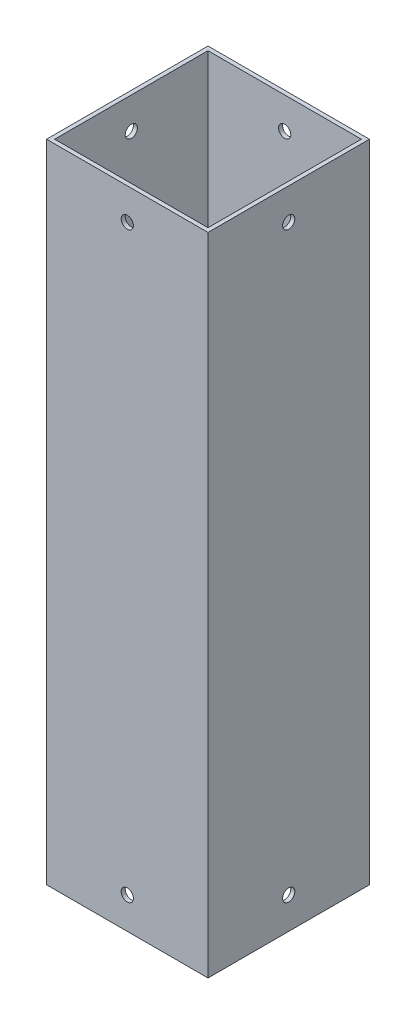
from build123d import *

# Parameters (mm, degrees)
SKETCH1_W               = 63.5
SKETCH1_H               = 63.5
SKETCH1_W_2             = 60.325
SKETCH1_H_2             = 60.325
BOSS_EXTRUDE1_DEPTH     = 254
SKETCH3_W               = 60.325
SKETCH3_H               = 60.325
BOSS_EXTRUDE3_DEPTH     = 2.54
CUT_EXTRUDE1_DEPTH      = 264.357589897
CUT_EXTRUDE1_DEPTH_BACK = 264.357589897
SKETCH4_R               = 2.3999952
SKETCH5_R               = 2.3999952
CUT_EXTRUDE2_DEPTH      = 264.735307648
CUT_EXTRUDE3_DEPTH      = 264.735307648
CUT_EXTRUDE3_DEPTH_BACK = 264.735307648
SKETCH6_R               = 2.3999952
CUT_EXTRUDE4_DEPTH      = 264.735307648
CUT_EXTRUDE4_DEPTH_BACK = 264.735307648
SKETCH7_R               = 2.3999952


with BuildPart() as part:
    # Sketch1 → Boss-Extrude1 (new body)
    with BuildSketch(Plane(origin=(0, 0, 0), x_dir=(1, 0, 0), z_dir=(0, 1, 0))):
        Rectangle(SKETCH1_W, SKETCH1_H)
        Rectangle(SKETCH1_W_2, SKETCH1_H_2, mode=Mode.SUBTRACT)
    extrude(amount=BOSS_EXTRUDE1_DEPTH)

    # Sketch3 → Boss-Extrude3 (add)
    with BuildSketch(Plane(origin=(0, 152.4, 0), x_dir=(1, 0, 0), z_dir=(0, 1, 0))):
        Rectangle(SKETCH3_W, SKETCH3_H)
    extrude(amount=-BOSS_EXTRUDE3_DEPTH)

    # Sketch4 → Cut-Extrude1 (cut, two sides: drawn at the far end of the back side and taken through both)
    with BuildSketch(Plane(origin=(-30.1625, 0, 0), x_dir=(0, 0, -1), z_dir=(1, 0, 0)).offset(-CUT_EXTRUDE1_DEPTH_BACK)):
        with Locations((0, 241.587599882)):
            Circle(SKETCH4_R)
    extrude(amount=CUT_EXTRUDE1_DEPTH + CUT_EXTRUDE1_DEPTH_BACK, mode=Mode.SUBTRACT)

    # Sketch5 → Cut-Extrude2 (cut, through all)
    with BuildSketch(Plane(origin=(0, 0, -31.75), x_dir=(-1, 0, 0), z_dir=(0, 0, -1))):
        with Locations((0, 241.587599882)):
            Circle(SKETCH5_R)
    extrude(amount=-CUT_EXTRUDE2_DEPTH, mode=Mode.SUBTRACT)

    # Sketch6 → Cut-Extrude3 (cut, two sides: drawn at the far end of the back side and taken through both)
    with BuildSketch(Plane(origin=(31.75, 0, 0), x_dir=(0, 0, -1), z_dir=(1, 0, 0)).offset(-CUT_EXTRUDE3_DEPTH_BACK)):
        with Locations((0, 12.412400118)):
            Circle(SKETCH6_R)
    extrude(amount=CUT_EXTRUDE3_DEPTH + CUT_EXTRUDE3_DEPTH_BACK, mode=Mode.SUBTRACT)

    # Sketch7 → Cut-Extrude4 (cut, two sides: drawn at the far end of the back side and taken through both)
    with BuildSketch(Plane(origin=(0, 0, -31.75), x_dir=(-1, 0, 0), z_dir=(0, 0, -1)).offset(-CUT_EXTRUDE4_DEPTH_BACK)):
        with Locations((0, 12.412400118)):
            Circle(SKETCH7_R)
    extrude(amount=CUT_EXTRUDE4_DEPTH + CUT_EXTRUDE4_DEPTH_BACK, mode=Mode.SUBTRACT)


solid = part.part
